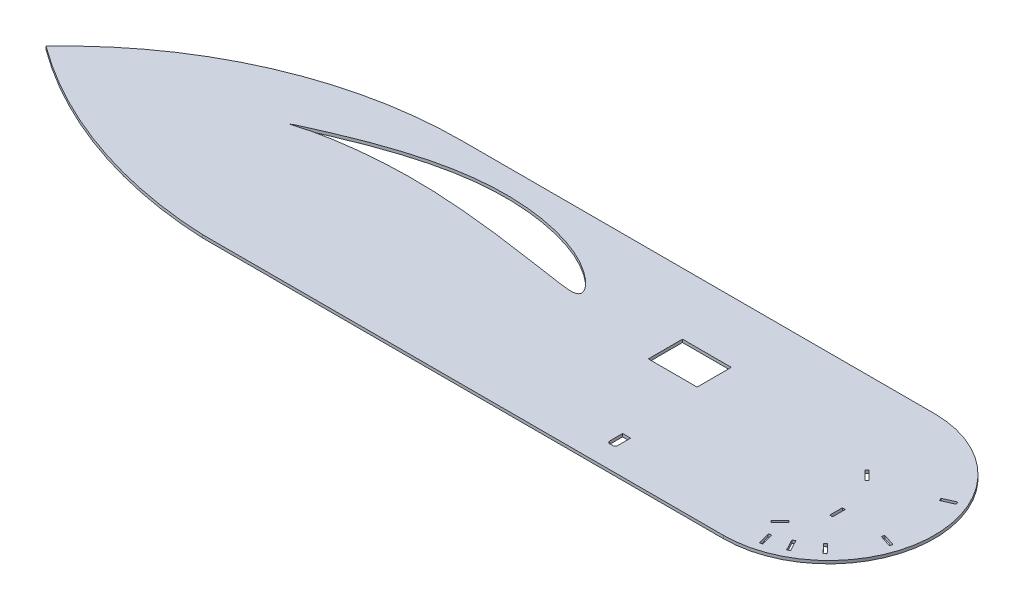
from build123d import *

# Parameters (mm, degrees)
BOSS_EXTRUDE1_DEPTH = 3
SKETCH2_W           = 50
SKETCH2_H           = 35
SKETCH2_W_2         = 3
SKETCH2_H_2         = 13
CUT_EXTRUDE1_DEPTH  = 934.342916617


with BuildPart() as part:
    # Sketch1 → Boss-Extrude1 (new body)
    with BuildSketch(Plane(origin=(0, 0, 0), x_dir=(1, 0, 0), z_dir=(0, 1, 0))):
        with BuildLine():
            Line((266.408252791, 0), (800, 0))
            ThreePointArc((800, 0), (908, 108), (800, 216))
            Line((800, 216), (316.294556964, 216))
            ThreePointArc((316.294556964, 216), (154.432198565, 182.326352039), (19.429068043, 86.893169221))
            ThreePointArc((19.429068043, 86.893169221), (136.475600537, 25.133273094), (266.408252791, 0))
        make_face()
    extrude(amount=BOSS_EXTRUDE1_DEPTH)

    # Sketch2 → Cut-Extrude1 (cut, through all)
    with BuildSketch(Plane.XZ):
        with Locations((630.07, -135.5)):
            Rectangle(SKETCH2_W, SKETCH2_H)
        Polygon((823.689305431, -121.232773416), (814.496917276, -130.425161571), (816.618237619, -132.546481915), (825.810625775, -123.354093759), align=None)
        Polygon((824.499870576, -25.039441419), (827.965072022, -12.50978145), (825.073612029, -11.710119578), (821.608410583, -24.239779547), align=None)
        with Locations((837.956551938, -78.816857662)):
            Rectangle(SKETCH2_W_2, SKETCH2_H_2)
        with BuildLine():
            Line((212.57, -142.261782597), (212.57, -142.294782597))
            add(Edge.make_bspline(
                [(212.57, -142.294782597), (212.815137814, -142.460102486), (213.721483955, -143.071338431), (215.664179604, -144.220627165), (218.723437449, -145.777902142), (222.783765044, -147.580430449), (227.75908382, -149.780753256), (233.673151887, -152.372942719), (243.334631626, -156.473964415), (254.071597155, -160.928560196), (265.811315632, -165.551386352), (275.559769605, -169.192616013), (285.820264156, -172.789650289), (300.213165162, -177.442893994), (315.047470761, -181.61442891), (330.216772764, -185.078244178), (341.716798025, -187.262793988), (353.238408154, -188.970546018), (364.74982071, -190.189827969), (376.222154657, -190.889317525), (387.611451467, -191.086885836), (398.853751386, -190.764655348), (413.421420996, -189.696341642), (427.580802498, -187.700042396), (441.195366572, -184.827458978), (450.821943115, -182.319735681), (459.948918056, -179.469695278), (468.511745548, -176.287644359), (476.453624938, -172.824739179), (483.715148146, -169.128859345), (490.24814377, -165.284833696), (496.019667561, -161.40694583), (500.998027396, -157.585747413), (505.147593549, -153.884087589), (508.447339472, -150.382728864), (510.852240131, -147.180842115), (512.23052565, -144.518995071), (512.672376723, -142.438033672), (512.365957104, -140.693980261), (510.836297954, -139.267947677), (508.300825673, -138.604557497), (504.990749494, -138.396901122), (500.845143819, -138.632879923), (495.886387834, -139.207005807), (490.127383335, -140.033765729), (483.600688533, -141.01415409), (476.345974836, -142.081971784), (468.41886468, -143.270863791), (459.86962452, -144.552957933), (447.40415706, -146.414008038), (434.302787697, -148.29198326), (413.230560269, -151.080307043), (394.916461571, -153.170522792), (372.413070638, -155.185169178), (353.278576878, -156.497400442), (334.10390548, -157.12050793), (318.83753012, -157.119300437), (307.569298967, -156.863067348), (296.54483902, -156.342386113), (285.853643217, -155.59861473), (275.586288909, -154.654588864), (265.829573747, -153.556930461), (256.673464041, -152.312824912), (248.205041684, -150.95854436), (240.510067524, -149.523302558), (233.666056009, -148.064077742), (227.735558734, -146.629571507), (222.771530443, -145.20558608), (218.774640723, -143.912633605), (215.724793866, -142.995242016), (213.753356987, -142.496728121), (212.816237246, -142.310670921), (212.57, -142.261782597)],
                knots=[0, 0, 0, 0, 0.001413477, 0.005226038, 0.010781091, 0.017815608, 0.026460951, 0.036790889, 0.048685593, 0.076639155, 0.092362872, 0.109003461, 0.126386903, 0.144339126, 0.181312719, 0.200023431, 0.218712626, 0.237261299, 0.255692478, 0.274037197, 0.292192583, 0.310132767, 0.327788163, 0.362001934, 0.378421226, 0.394286639, 0.40954344, 0.424114253, 0.43793778, 0.450941833, 0.463044023, 0.474154417, 0.484164575, 0.493023962, 0.500713088, 0.507125739, 0.512129705, 0.514904185, 0.517171427, 0.520261618, 0.5242453, 0.529497961, 0.536092185, 0.54406114, 0.553363127, 0.563904543, 0.575614949, 0.588420092, 0.60222661, 0.616944448, 0.648675826, 0.665501113, 0.718564132, 0.736789145, 0.773513212, 0.810244924, 0.828488569, 0.846493195, 0.864125178, 0.88124851, 0.897725282, 0.913415058, 0.928184346, 0.941897285, 0.954411455, 0.965602702, 0.975349728, 0.983575522, 0.990284579, 0.99543259, 0.998799869, 1, 1, 1, 1], degree=3))
        make_face()
        with BuildLine():
            Line((658.07, -25.47338103), (658.07, -38.67338103))
            Line((658.07, -38.67338103), (666.27, -38.67338103))
            Line((666.27, -38.67338103), (666.27, -25.47338103))
            ThreePointArc((666.27, -25.47338103), (665.537766953, -23.705614077), (663.77, -22.97338103))
            Line((663.77, -22.97338103), (660.57, -22.97338103))
            ThreePointArc((660.57, -22.97338103), (658.802233047, -23.705614077), (658.07, -25.47338103))
        make_face()
        Polygon((878.544472029, -144.241741844), (890.4411618, -149.482807814), (891.650638562, -146.737417867), (879.753948792, -141.496351897), align=None)
        Polygon((882.697354327, -82.625888674), (895.057492527, -78.597615636), (894.127891057, -75.745276051), (881.767752857, -79.773549089), align=None)
        Polygon((860.535923167, -46.209224437), (869.471139857, -36.766666379), (867.292087998, -34.704693296), (858.356871307, -44.147251355), align=None)
        Polygon((841.855043451, -32.297600592), (847.946981387, -20.813337787), (845.296766893, -19.407505955), (839.204828958, -30.891768761), align=None)
        Polygon((822.408918341, -44.734564453), (813.216530186, -35.542176297), (811.095209842, -37.663496641), (820.287597998, -46.855884796), align=None)
    extrude(amount=-CUT_EXTRUDE1_DEPTH, mode=Mode.SUBTRACT)


solid = part.part
